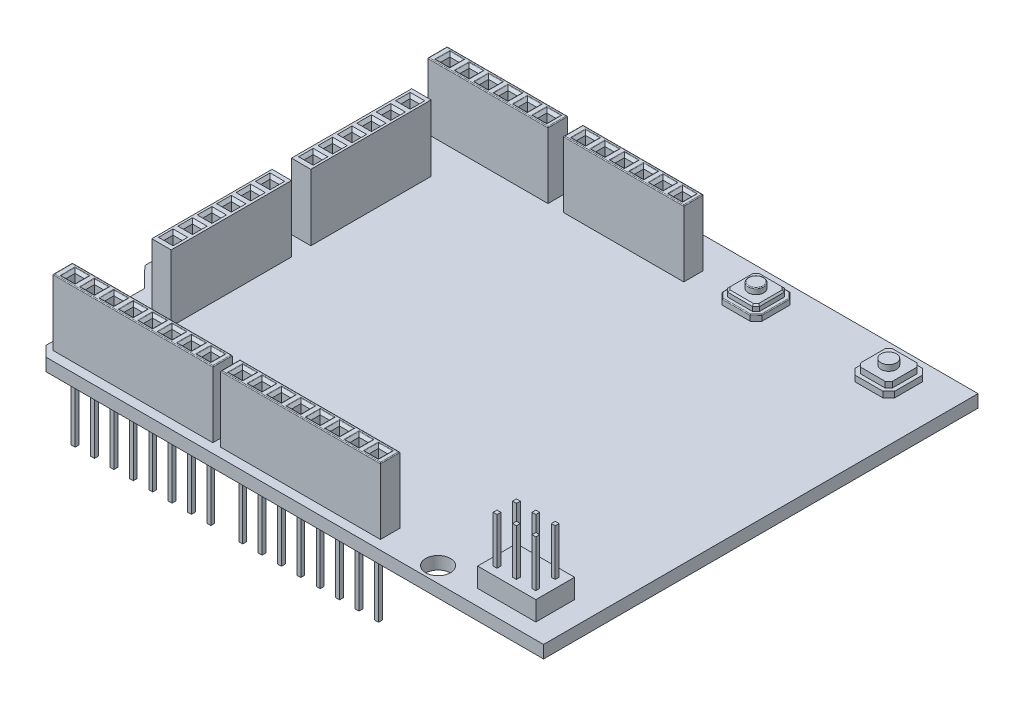
from build123d import *

# Parameters (mm, degrees)
SKETCH1_W            = 68
SKETCH1_H            = 56
BOSS_EXTRUDE1_DEPTH  = 1.63
SKETCH2_W            = 15.5
SKETCH2_H            = 2.5
SKETCH2_W_2          = 20.6
SKETCH2_W_3          = 2.5
SKETCH2_H_2          = 15.5
BOSS_EXTRUDE2_DEPTH  = 8.54
BOSS_EXTRUDE3_DEPTH  = 0.75
BOSS_EXTRUDE4_DEPTH  = 0.75
SKETCH5_R            = 1
BOSS_EXTRUDE5_DEPTH  = 0.75
CHAMFER1_SIZE        = 0.2
FILLET1_R            = 0.1
FILLET2_R            = 0.1
SKETCH7_W            = 1.18
SKETCH7_H            = 1.18
CUT_EXTRUDE1_DEPTH   = 6.58
CHAMFER3_SIZE        = 0.35
CUT_EXTRUDE2_DEPTH   = 45.86570628
CHAMFER5_SIZE        = 1.32
SKETCH11_W           = 0.5
SKETCH11_H           = 0.5
BOSS_EXTRUDE8_DEPTH  = 8.75
FILLET5_R            = 0.1
SKETCH12_R           = 1.6
CUT_EXTRUDE4_DEPTH   = 46.2520099
SKETCH18_W           = 7.5
SKETCH18_H           = 5
BOSS_EXTRUDE9_DEPTH  = 2.5
SKETCH19_W           = 0.5
SKETCH19_H           = 0.5
BOSS_EXTRUDE10_DEPTH = 6
LPATTERN6_COUNT      = 2
LPATTERN6_PITCH      = 2.5
LPATTERN6_COUNT_DIR2 = 3
LPATTERN6_PITCH_DIR2 = 2.5


with BuildPart() as part:
    # Sketch1 → Boss-Extrude1 (new body)
    with BuildSketch(Plane(origin=(0, 0, 0), x_dir=(1, 0, 0), z_dir=(0, 1, 0))):
        Rectangle(SKETCH1_W, SKETCH1_H)
    extrude(amount=BOSS_EXTRUDE1_DEPTH)

    # Sketch2 → Boss-Extrude2 (add)
    with BuildSketch(Plane(origin=(0, 1.63, 0), x_dir=(1, 0, 0), z_dir=(0, 1, 0))):
        with Locations((-22.68, 22.75)):
            Rectangle(SKETCH2_W, SKETCH2_H)
        with Locations((-5.18, 22.75)):
            Rectangle(SKETCH2_W, SKETCH2_H)
        with Locations((1.47, -25.55)):
            Rectangle(SKETCH2_W_2, SKETCH2_H)
        with Locations((-20.13, -25.55)):
            Rectangle(SKETCH2_W_2, SKETCH2_H)
        with Locations((-26.75, 9.25)):
            Rectangle(SKETCH2_W_3, SKETCH2_H_2)
        with Locations((-26.75, -8.75)):
            Rectangle(SKETCH2_W_3, SKETCH2_H_2)
    extrude(amount=BOSS_EXTRUDE2_DEPTH)

    # Sketch3 → Boss-Extrude3 (add)
    with BuildSketch(Plane(origin=(0, 1.63, 0), x_dir=(1, 0, 0), z_dir=(0, 1, 0))):
        Polygon((7.64, 26.5), (11.25, 26.5), (12, 25.75), (12, 22.14), (11.25, 21.39), (7.64, 21.39), (6.89, 22.14), (6.89, 25.75), align=None)
    boss_extrude3 = extrude(amount=BOSS_EXTRUDE3_DEPTH)

    # Sketch4 → Boss-Extrude4 (add)
    with BuildSketch(Plane(origin=(0, 2.38, 0), x_dir=(1, 0, 0), z_dir=(0, 1, 0))):
        Polygon((7.39, 22.347106781), (7.847106781, 21.89), (11.042893219, 21.89), (11.5, 22.347106781), (11.5, 25.542893219), (11.042893219, 26), (7.847106781, 26), (7.39, 25.542893219), align=None)
    boss_extrude4 = extrude(amount=BOSS_EXTRUDE4_DEPTH)

    # Sketch5 → Boss-Extrude5 (add)
    with BuildSketch(Plane(origin=(0, 3.13, 0), x_dir=(1, 0, 0), z_dir=(0, 1, 0))):
        with Locations((9.445, 23.945)):
            Circle(SKETCH5_R)
    boss_extrude5 = extrude(amount=BOSS_EXTRUDE5_DEPTH)

    # Chamfer1
    chamfer1_edges = [part.edges().sort_by_distance(p)[0] for p in [
        (7.618553391, 3.13, -25.771446609),
        (9.445, 3.13, -26),
        (11.271446609, 3.13, -25.771446609),
        (7.39, 3.13, -23.945),
        (7.618553391, 3.13, -22.118553391),
        (9.445, 3.13, -21.89),
        (11.271446609, 3.13, -22.118553391),
        (11.5, 3.13, -23.945),
    ]]
    chamfer(chamfer1_edges, length=CHAMFER1_SIZE)

    # Fillet1
    fillet1_edges = [part.edges().sort_by_distance(p)[0] for p in [
        (8.445, 3.88, -23.945),
    ]]
    fillet(fillet1_edges, radius=FILLET1_R)

    # Fillet2
    fillet2_edges = [part.edges().sort_by_distance(p)[0] for p in [
        (7.265, 2.38, -21.765),
        (6.89, 2.38, -23.945),
        (7.265, 2.38, -26.125),
        (9.445, 2.38, -26.5),
        (11.625, 2.38, -26.125),
        (9.445, 2.38, -21.39),
        (11.625, 2.38, -21.765),
        (12, 2.38, -23.945),
    ]]
    fillet(fillet2_edges, radius=FILLET2_R)

    # Sketch7 → Cut-Extrude1 (cut)
    with BuildSketch(Plane(origin=(0, 10.17, 0), x_dir=(1, 0, 0), z_dir=(0, 1, 0))):
        with Locations((-28.84, 22.75)):
            Rectangle(SKETCH7_W, SKETCH7_H)
        with Locations((-26.34, 22.75)):
            Rectangle(SKETCH7_W, SKETCH7_H)
        with Locations((-23.84, 22.75)):
            Rectangle(SKETCH7_W, SKETCH7_H)
        with Locations((-21.34, 22.75)):
            Rectangle(SKETCH7_W, SKETCH7_H)
        with Locations((-18.84, 22.75)):
            Rectangle(SKETCH7_W, SKETCH7_H)
        with Locations((-16.34, 22.75)):
            Rectangle(SKETCH7_W, SKETCH7_H)
        with Locations((-28.84, -25.55)):
            Rectangle(SKETCH7_W, SKETCH7_H)
        with Locations((-11.34, 22.75)):
            Rectangle(SKETCH7_W, SKETCH7_H)
        with Locations((-8.84, 22.75)):
            Rectangle(SKETCH7_W, SKETCH7_H)
        with Locations((-6.34, 22.75)):
            Rectangle(SKETCH7_W, SKETCH7_H)
        with Locations((-3.84, 22.75)):
            Rectangle(SKETCH7_W, SKETCH7_H)
        with Locations((-1.34, 22.75)):
            Rectangle(SKETCH7_W, SKETCH7_H)
        with Locations((1.16, 22.75)):
            Rectangle(SKETCH7_W, SKETCH7_H)
        with Locations((-26.34, -25.55)):
            Rectangle(SKETCH7_W, SKETCH7_H)
        with Locations((-23.84, -25.55)):
            Rectangle(SKETCH7_W, SKETCH7_H)
        with Locations((-21.34, -25.55)):
            Rectangle(SKETCH7_W, SKETCH7_H)
        with Locations((-18.84, -25.55)):
            Rectangle(SKETCH7_W, SKETCH7_H)
        with Locations((-16.34, -25.55)):
            Rectangle(SKETCH7_W, SKETCH7_H)
        with Locations((-13.84, -25.55)):
            Rectangle(SKETCH7_W, SKETCH7_H)
        with Locations((-11.34, -25.55)):
            Rectangle(SKETCH7_W, SKETCH7_H)
        with Locations((-7.24, -25.55)):
            Rectangle(SKETCH7_W, SKETCH7_H)
        with Locations((-4.74, -25.55)):
            Rectangle(SKETCH7_W, SKETCH7_H)
        with Locations((-2.24, -25.55)):
            Rectangle(SKETCH7_W, SKETCH7_H)
        with Locations((0.26, -25.55)):
            Rectangle(SKETCH7_W, SKETCH7_H)
        with Locations((2.76, -25.55)):
            Rectangle(SKETCH7_W, SKETCH7_H)
        with Locations((5.26, -25.55)):
            Rectangle(SKETCH7_W, SKETCH7_H)
        with Locations((7.76, -25.55)):
            Rectangle(SKETCH7_W, SKETCH7_H)
        with Locations((10.26, -25.55)):
            Rectangle(SKETCH7_W, SKETCH7_H)
        with Locations((-26.748603854, 15.551491297)):
            Rectangle(SKETCH7_W, SKETCH7_H)
        with Locations((-26.748603854, 13.051491297)):
            Rectangle(SKETCH7_W, SKETCH7_H)
        with Locations((-26.748603854, 10.551491297)):
            Rectangle(SKETCH7_W, SKETCH7_H)
        with Locations((-26.748603854, 8.051491297)):
            Rectangle(SKETCH7_W, SKETCH7_H)
        with Locations((-26.748603854, 5.551491297)):
            Rectangle(SKETCH7_W, SKETCH7_H)
        with Locations((-26.748603854, 3.051491297)):
            Rectangle(SKETCH7_W, SKETCH7_H)
        with Locations((-26.783884438, -2.474589496)):
            Rectangle(SKETCH7_W, SKETCH7_H)
        with Locations((-26.783884438, -4.974589496)):
            Rectangle(SKETCH7_W, SKETCH7_H)
        with Locations((-26.783884438, -7.474589496)):
            Rectangle(SKETCH7_W, SKETCH7_H)
        with Locations((-26.783884438, -9.974589496)):
            Rectangle(SKETCH7_W, SKETCH7_H)
        with Locations((-26.783884438, -12.474589496)):
            Rectangle(SKETCH7_W, SKETCH7_H)
        with Locations((-26.783884438, -14.974589496)):
            Rectangle(SKETCH7_W, SKETCH7_H)
    extrude(amount=-CUT_EXTRUDE1_DEPTH, mode=Mode.SUBTRACT)

    # Chamfer3
    chamfer3_edges = [part.edges().sort_by_distance(p)[0] for p in [
        (-28.84, 10.17, -22.16),
        (-28.25, 10.17, -22.75),
        (-29.43, 10.17, -22.75),
        (-28.84, 10.17, -23.34),
        (10.26, 10.17, 26.14),
        (10.85, 10.17, 25.55),
        (9.67, 10.17, 25.55),
        (10.26, 10.17, 24.96),
        (7.76, 10.17, 26.14),
        (8.35, 10.17, 25.55),
        (7.17, 10.17, 25.55),
        (7.76, 10.17, 24.96),
        (5.26, 10.17, 26.14),
        (5.85, 10.17, 25.55),
        (4.67, 10.17, 25.55),
        (5.26, 10.17, 24.96),
        (2.76, 10.17, 26.14),
        (3.35, 10.17, 25.55),
        (2.17, 10.17, 25.55),
        (2.76, 10.17, 24.96),
        (0.26, 10.17, 26.14),
        (0.85, 10.17, 25.55),
        (-0.33, 10.17, 25.55),
        (0.26, 10.17, 24.96),
        (-2.24, 10.17, 26.14),
        (-1.65, 10.17, 25.55),
        (-2.83, 10.17, 25.55),
        (-2.24, 10.17, 24.96),
        (-4.74, 10.17, 26.14),
        (-4.15, 10.17, 25.55),
        (-5.33, 10.17, 25.55),
        (-4.74, 10.17, 24.96),
        (-7.24, 10.17, 26.14),
        (-6.65, 10.17, 25.55),
        (-7.83, 10.17, 25.55),
        (-7.24, 10.17, 24.96),
        (-11.34, 10.17, 26.14),
        (-11.93, 10.17, 25.55),
        (-10.75, 10.17, 25.55),
        (-11.34, 10.17, 24.96),
        (-13.84, 10.17, 26.14),
        (-14.43, 10.17, 25.55),
        (-13.25, 10.17, 25.55),
        (-13.84, 10.17, 24.96),
        (-16.34, 10.17, 26.14),
        (-16.93, 10.17, 25.55),
        (-15.75, 10.17, 25.55),
        (-16.34, 10.17, 24.96),
        (-18.84, 10.17, 26.14),
        (-19.43, 10.17, 25.55),
        (-18.25, 10.17, 25.55),
        (-18.84, 10.17, 24.96),
        (-21.34, 10.17, 26.14),
        (-21.93, 10.17, 25.55),
        (-20.75, 10.17, 25.55),
        (-21.34, 10.17, 24.96),
        (-23.84, 10.17, 26.14),
        (-24.43, 10.17, 25.55),
        (-23.25, 10.17, 25.55),
        (-23.84, 10.17, 24.96),
        (-26.34, 10.17, 26.14),
        (-26.93, 10.17, 25.55),
        (-25.75, 10.17, 25.55),
        (-26.34, 10.17, 24.96),
        (-28.84, 10.17, 26.14),
        (-29.43, 10.17, 25.55),
        (-28.25, 10.17, 25.55),
        (-28.84, 10.17, 24.96),
        (1.16, 10.17, -23.34),
        (0.57, 10.17, -22.75),
        (1.75, 10.17, -22.75),
        (1.16, 10.17, -22.16),
        (-1.34, 10.17, -23.34),
        (-1.93, 10.17, -22.75),
        (-0.75, 10.17, -22.75),
        (-1.34, 10.17, -22.16),
        (-3.84, 10.17, -23.34),
        (-4.43, 10.17, -22.75),
        (-3.25, 10.17, -22.75),
        (-3.84, 10.17, -22.16),
        (-6.34, 10.17, -23.34),
        (-6.93, 10.17, -22.75),
        (-5.75, 10.17, -22.75),
        (-6.34, 10.17, -22.16),
        (-8.84, 10.17, -23.34),
        (-9.43, 10.17, -22.75),
        (-8.25, 10.17, -22.75),
        (-8.84, 10.17, -22.16),
        (-11.34, 10.17, -23.34),
        (-11.93, 10.17, -22.75),
        (-10.75, 10.17, -22.75),
        (-11.34, 10.17, -22.16),
        (-16.34, 10.17, -22.16),
        (-16.93, 10.17, -22.75),
        (-16.34, 10.17, -23.34),
        (-15.75, 10.17, -22.75),
        (-19.43, 10.17, -22.75),
        (-18.84, 10.17, -23.34),
        (-18.25, 10.17, -22.75),
        (-18.84, 10.17, -22.16),
        (-21.93, 10.17, -22.75),
        (-21.34, 10.17, -23.34),
        (-20.75, 10.17, -22.75),
        (-21.34, 10.17, -22.16),
        (-24.43, 10.17, -22.75),
        (-23.84, 10.17, -23.34),
        (-23.25, 10.17, -22.75),
        (-23.84, 10.17, -22.16),
        (-26.34, 10.17, -22.16),
        (-25.75, 10.17, -22.75),
        (-26.93, 10.17, -22.75),
        (-26.34, 10.17, -23.34),
        (-26.783884438, 10.17, 15.564589496),
        (-26.193884438, 10.17, 14.974589496),
        (-27.373884438, 10.17, 14.974589496),
        (-26.783884438, 10.17, 14.384589496),
        (-26.783884438, 10.17, 13.064589496),
        (-26.193884438, 10.17, 12.474589496),
        (-27.373884438, 10.17, 12.474589496),
        (-26.783884438, 10.17, 11.884589496),
        (-26.783884438, 10.17, 10.564589496),
        (-26.193884438, 10.17, 9.974589496),
        (-27.373884438, 10.17, 9.974589496),
        (-26.783884438, 10.17, 9.384589496),
        (-26.783884438, 10.17, 8.064589496),
        (-26.193884438, 10.17, 7.474589496),
        (-27.373884438, 10.17, 7.474589496),
        (-26.783884438, 10.17, 6.884589496),
        (-26.783884438, 10.17, 5.564589496),
        (-26.193884438, 10.17, 4.974589496),
        (-27.373884438, 10.17, 4.974589496),
        (-26.783884438, 10.17, 4.384589496),
        (-26.783884438, 10.17, 3.064589496),
        (-26.193884438, 10.17, 2.474589496),
        (-27.373884438, 10.17, 2.474589496),
        (-26.783884438, 10.17, 1.884589496),
        (-26.748603854, 10.17, -2.461491297),
        (-26.158603854, 10.17, -3.051491297),
        (-27.338603854, 10.17, -3.051491297),
        (-26.748603854, 10.17, -3.641491297),
        (-26.748603854, 10.17, -6.141491297),
        (-27.338603854, 10.17, -5.551491297),
        (-26.748603854, 10.17, -4.961491297),
        (-26.158603854, 10.17, -5.551491297),
        (-26.748603854, 10.17, -7.461491297),
        (-26.158603854, 10.17, -8.051491297),
        (-27.338603854, 10.17, -8.051491297),
        (-26.748603854, 10.17, -8.641491297),
        (-26.748603854, 10.17, -9.961491297),
        (-26.158603854, 10.17, -10.551491297),
        (-27.338603854, 10.17, -10.551491297),
        (-26.748603854, 10.17, -11.141491297),
        (-26.748603854, 10.17, -12.461491297),
        (-27.338603854, 10.17, -13.051491297),
        (-26.748603854, 10.17, -13.641491297),
        (-26.158603854, 10.17, -13.051491297),
        (-26.158603854, 10.17, -15.551491297),
        (-26.748603854, 10.17, -16.141491297),
        (-27.338603854, 10.17, -15.551491297),
        (-26.748603854, 10.17, -14.961491297),
    ]]
    chamfer(chamfer3_edges, length=CHAMFER3_SIZE)

    # Sketch8 → Cut-Extrude2 (cut, through all)
    with BuildSketch(Plane(origin=(0, 1.63, 0), x_dir=(1, 0, 0), z_dir=(0, 1, 0))):
        Polygon((-31.46, 28), (-31.46, 24.34), (-34, 21.3), (-34, 28), align=None)
        Polygon((-31.46, -14), (-31.46, -28), (-34, -28), (-34, -11.4), align=None)
    extrude(amount=-CUT_EXTRUDE2_DEPTH, mode=Mode.SUBTRACT)

    # Chamfer5
    chamfer5_edges = [part.edges().sort_by_distance(p)[0] for p in [
        (-31.46, 0.815, 28),
    ]]
    chamfer(chamfer5_edges, length=CHAMFER5_SIZE)

    # Sketch11 → Boss-Extrude8 (add)
    with BuildSketch(Plane.XZ):
        with Locations((-26.34, 25.55)):
            Rectangle(SKETCH11_W, SKETCH11_H)
        with Locations((-28.84, 25.55)):
            Rectangle(SKETCH11_W, SKETCH11_H)
        with Locations((-23.84, 25.55)):
            Rectangle(SKETCH11_W, SKETCH11_H)
        with Locations((-21.34, 25.55)):
            Rectangle(SKETCH11_W, SKETCH11_H)
        with Locations((-18.84, 25.55)):
            Rectangle(SKETCH11_W, SKETCH11_H)
        with Locations((-16.34, 25.55)):
            Rectangle(SKETCH11_W, SKETCH11_H)
        with Locations((-13.84, 25.55)):
            Rectangle(SKETCH11_W, SKETCH11_H)
        with Locations((-11.34, 25.55)):
            Rectangle(SKETCH11_W, SKETCH11_H)
        with Locations((-4.74, 25.55)):
            Rectangle(SKETCH11_W, SKETCH11_H)
        with Locations((-7.24, 25.55)):
            Rectangle(SKETCH11_W, SKETCH11_H)
        with Locations((-2.24, 25.55)):
            Rectangle(SKETCH11_W, SKETCH11_H)
        with Locations((0.26, 25.55)):
            Rectangle(SKETCH11_W, SKETCH11_H)
        with Locations((2.76, 25.55)):
            Rectangle(SKETCH11_W, SKETCH11_H)
        with Locations((5.26, 25.55)):
            Rectangle(SKETCH11_W, SKETCH11_H)
        with Locations((7.76, 25.55)):
            Rectangle(SKETCH11_W, SKETCH11_H)
        with Locations((10.26, 25.55)):
            Rectangle(SKETCH11_W, SKETCH11_H)
        with Locations((-26.34, -22.75)):
            Rectangle(SKETCH11_W, SKETCH11_H)
        with Locations((-28.84, -22.75)):
            Rectangle(SKETCH11_W, SKETCH11_H)
        with Locations((-23.84, -22.75)):
            Rectangle(SKETCH11_W, SKETCH11_H)
        with Locations((-21.34, -22.75)):
            Rectangle(SKETCH11_W, SKETCH11_H)
        with Locations((-18.84, -22.75)):
            Rectangle(SKETCH11_W, SKETCH11_H)
        with Locations((-16.34, -22.75)):
            Rectangle(SKETCH11_W, SKETCH11_H)
        with Locations((-11.34, -22.75)):
            Rectangle(SKETCH11_W, SKETCH11_H)
        with Locations((-8.84, -22.75)):
            Rectangle(SKETCH11_W, SKETCH11_H)
        with Locations((-6.34, -22.75)):
            Rectangle(SKETCH11_W, SKETCH11_H)
        with Locations((-3.84, -22.75)):
            Rectangle(SKETCH11_W, SKETCH11_H)
        with Locations((-1.34, -22.75)):
            Rectangle(SKETCH11_W, SKETCH11_H)
        with Locations((1.16, -22.75)):
            Rectangle(SKETCH11_W, SKETCH11_H)
    extrude(amount=BOSS_EXTRUDE8_DEPTH)

    # Fillet5
    fillet5_edges = [part.edges().sort_by_distance(p)[0] for p in [
        (-12.93, 10.17, -22.75),
        (-5.18, 10.17, -24),
        (2.57, 10.17, -22.75),
        (-5.18, 10.17, -21.5),
        (-11.34, 10.17, -21.81),
        (-10.4, 10.17, -22.75),
        (-11.34, 10.17, -23.69),
        (-12.28, 10.17, -22.75),
        (-8.84, 10.17, -21.81),
        (-7.9, 10.17, -22.75),
        (-8.84, 10.17, -23.69),
        (-9.78, 10.17, -22.75),
        (-6.34, 10.17, -21.81),
        (-5.4, 10.17, -22.75),
        (-6.34, 10.17, -23.69),
        (-7.28, 10.17, -22.75),
        (-3.84, 10.17, -21.81),
        (-2.9, 10.17, -22.75),
        (-3.84, 10.17, -23.69),
        (-4.78, 10.17, -22.75),
        (-1.34, 10.17, -21.81),
        (-0.4, 10.17, -22.75),
        (-1.34, 10.17, -23.69),
        (-2.28, 10.17, -22.75),
        (1.16, 10.17, -21.81),
        (2.1, 10.17, -22.75),
        (1.16, 10.17, -23.69),
        (0.22, 10.17, -22.75),
        (-22.68, 10.17, -21.5),
        (-30.43, 10.17, -22.75),
        (-22.68, 10.17, -24),
        (-14.93, 10.17, -22.75),
        (-28.84, 10.17, -23.69),
        (-29.78, 10.17, -22.75),
        (-28.84, 10.17, -21.81),
        (-27.9, 10.17, -22.75),
        (-26.34, 10.17, -23.69),
        (-27.28, 10.17, -22.75),
        (-26.34, 10.17, -21.81),
        (-25.4, 10.17, -22.75),
        (-22.9, 10.17, -22.75),
        (-23.84, 10.17, -23.69),
        (-24.78, 10.17, -22.75),
        (-23.84, 10.17, -21.81),
        (-20.4, 10.17, -22.75),
        (-21.34, 10.17, -23.69),
        (-22.28, 10.17, -22.75),
        (-21.34, 10.17, -21.81),
        (-17.9, 10.17, -22.75),
        (-18.84, 10.17, -23.69),
        (-19.78, 10.17, -22.75),
        (-18.84, 10.17, -21.81),
        (-16.34, 10.17, -23.69),
        (-17.28, 10.17, -22.75),
        (-16.34, 10.17, -21.81),
        (-15.4, 10.17, -22.75),
        (-7.24, 10.17, 24.61),
        (-8.18, 10.17, 25.55),
        (-7.24, 10.17, 26.49),
        (-6.3, 10.17, 25.55),
        (-4.74, 10.17, 24.61),
        (-5.68, 10.17, 25.55),
        (-4.74, 10.17, 26.49),
        (-3.8, 10.17, 25.55),
        (-2.24, 10.17, 24.61),
        (-3.18, 10.17, 25.55),
        (-2.24, 10.17, 26.49),
        (-1.3, 10.17, 25.55),
        (0.26, 10.17, 24.61),
        (-0.68, 10.17, 25.55),
        (0.26, 10.17, 26.49),
        (1.2, 10.17, 25.55),
        (2.76, 10.17, 24.61),
        (1.82, 10.17, 25.55),
        (2.76, 10.17, 26.49),
        (3.7, 10.17, 25.55),
        (5.26, 10.17, 24.61),
        (4.32, 10.17, 25.55),
        (5.26, 10.17, 26.49),
        (6.2, 10.17, 25.55),
        (7.76, 10.17, 24.61),
        (6.82, 10.17, 25.55),
        (7.76, 10.17, 26.49),
        (8.7, 10.17, 25.55),
        (10.26, 10.17, 24.61),
        (9.32, 10.17, 25.55),
        (10.26, 10.17, 26.49),
        (11.2, 10.17, 25.55),
        (-20.13, 10.17, 26.8),
        (-30.43, 10.17, 25.55),
        (-20.13, 10.17, 24.3),
        (-9.83, 10.17, 25.55),
        (-28.84, 10.17, 24.61),
        (-29.78, 10.17, 25.55),
        (-28.84, 10.17, 26.49),
        (-27.9, 10.17, 25.55),
        (-26.34, 10.17, 24.61),
        (-27.28, 10.17, 25.55),
        (-26.34, 10.17, 26.49),
        (-25.4, 10.17, 25.55),
        (-23.84, 10.17, 24.61),
        (-24.78, 10.17, 25.55),
        (-23.84, 10.17, 26.49),
        (-22.9, 10.17, 25.55),
        (-21.34, 10.17, 24.61),
        (-22.28, 10.17, 25.55),
        (-21.34, 10.17, 26.49),
        (-20.4, 10.17, 25.55),
        (-18.84, 10.17, 24.61),
        (-19.78, 10.17, 25.55),
        (-18.84, 10.17, 26.49),
        (-17.9, 10.17, 25.55),
        (-16.34, 10.17, 24.61),
        (-17.28, 10.17, 25.55),
        (-16.34, 10.17, 26.49),
        (-15.4, 10.17, 25.55),
        (-13.84, 10.17, 24.61),
        (-14.78, 10.17, 25.55),
        (-13.84, 10.17, 26.49),
        (-12.9, 10.17, 25.55),
        (-11.34, 10.17, 24.61),
        (-12.28, 10.17, 25.55),
        (-11.34, 10.17, 26.49),
        (-10.4, 10.17, 25.55),
        (-8.83, 10.17, 25.55),
        (1.47, 10.17, 24.3),
        (11.77, 10.17, 25.55),
        (1.47, 10.17, 26.8),
    ]]
    fillet(fillet5_edges, radius=FILLET5_R)

    # Mirror1: Boss-Extrude3, Boss-Extrude4, Boss-Extrude5 across plane
    add(boss_extrude3.mirror(Plane(origin=(18, 0, 0), x_dir=(0, 0, 1), z_dir=(1, 0, 0))))
    add(boss_extrude4.mirror(Plane(origin=(18, 0, 0), x_dir=(0, 0, 1), z_dir=(1, 0, 0))))
    add(boss_extrude5.mirror(Plane(origin=(18, 0, 0), x_dir=(0, 0, 1), z_dir=(1, 0, 0))))

    # Sketch12 → Cut-Extrude4 (cut, through all)
    with BuildSketch(Plane(origin=(0, 1.63, 0), x_dir=(1, 0, 0), z_dir=(0, 1, 0))):
        with Locations((-32, -7.5)):
            Circle(SKETCH12_R)
        with Locations((18.4, -26)):
            Circle(SKETCH12_R)
    extrude(amount=-CUT_EXTRUDE4_DEPTH, mode=Mode.SUBTRACT)

    # Sketch18 → Boss-Extrude9 (add)
    with BuildSketch(Plane(origin=(0, 1.63, 0), x_dir=(1, 0, 0), z_dir=(0, 1, 0))):
        with Locations((27.25, -23.5)):
            Rectangle(SKETCH18_W, SKETCH18_H)
    extrude(amount=BOSS_EXTRUDE9_DEPTH)

    # Sketch19 → Boss-Extrude10 (add)
    with BuildSketch(Plane(origin=(0, 4.13, 0), x_dir=(1, 0, 0), z_dir=(0, 1, 0))):
        with Locations((24.75, -22.25)):
            Rectangle(SKETCH19_W, SKETCH19_H)
    boss_extrude10 = extrude(amount=BOSS_EXTRUDE10_DEPTH)

    # LPattern6: Boss-Extrude10 2 × 3
    with Locations(*[(j * LPATTERN6_PITCH_DIR2, 0, i * LPATTERN6_PITCH) for i in range(LPATTERN6_COUNT) for j in range(LPATTERN6_COUNT_DIR2) if (i, j) != (0, 0)]):
        add(boss_extrude10)


solid = part.part
